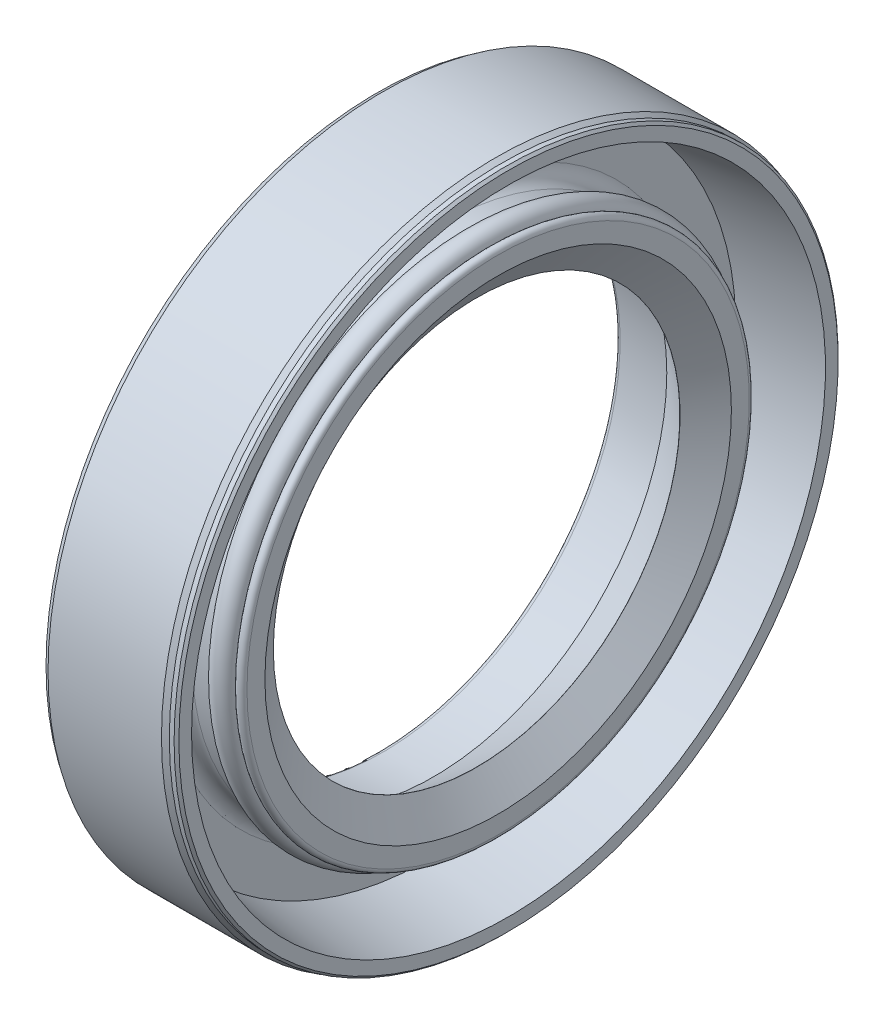
from build123d import *


with BuildPart() as part:
    # Sketch1 → Revolve2 (revolve)
    with BuildSketch(Plane.XY):
        with BuildLine():
            Line((0.9025, 10.5), (0.9025, 9.75))
            Line((0.9025, 9.75), (0.005, 8.5))
            Line((0.005, 8.5), (0, 8.5))
            Line((0, 8.5), (-1.7975, 9.75))
            Line((-1.7975, 9.75), (-3.935955602, 9.937090623))
            ThreePointArc((-3.935955602, 9.937090623), (-4.098486001, 10.017241745), (-4.164166667, 10.186139297))
            Line((-4.164166667, 10.186139297), (-4.164166667, 13.833333333))
            Line((-4.164166667, 13.833333333), (-3.914166667, 14))
            Line((-3.914166667, 14), (0.827987236, 14))
            Line((0.827987236, 14), (1.035833333, 13.88))
            Line((1.035833333, 13.88), (1.235833333, 13.88))
            Line((1.235833333, 13.88), (1.335833333, 13.78))
            Line((1.335833333, 13.78), (1.335833333, 13.25))
            Line((1.335833333, 13.25), (-1.9975, 12.833333333))
            Line((-1.9975, 12.833333333), (-1.9975, 11.1))
            ThreePointArc((-1.9975, 11.1), (-1.821764069, 10.675735931), (-1.3975, 10.5))
            Line((-1.3975, 10.5), (-0.4975, 10.5))
            ThreePointArc((-0.4975, 10.5), (0.0025, 11), (0.5025, 10.5))
            ThreePointArc((0.5025, 10.5), (0.7025, 10.7), (0.9025, 10.5))
        make_face()
    revolve(axis=Axis((0, 0, 0), (1, 0, 0)))


solid = part.part
